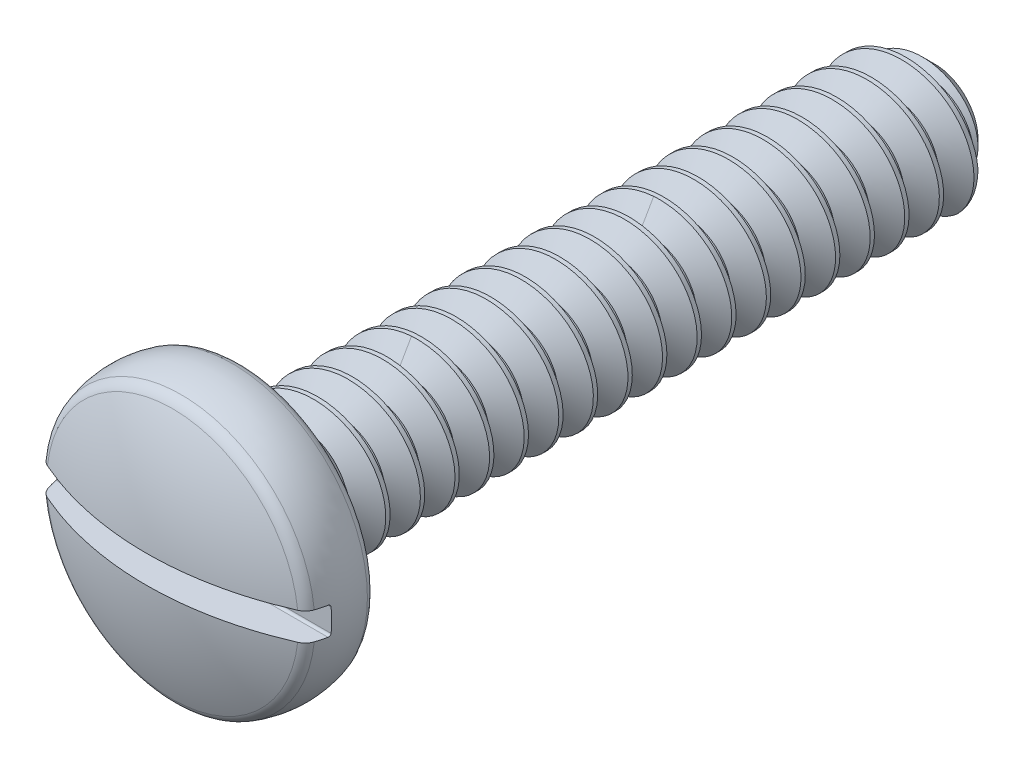
from build123d import *

# Parameters (mm, degrees)
CUT_EXTRUDE1_DEPTH      = 4.181587717
CUT_EXTRUDE1_DEPTH_BACK = 4.181587717
SKETCH9_W               = 0.35
SKETCH9_H               = 0.2
FILLET1_R               = 0.0175
FILLET2_R               = 0.105
CHAMFER1_SIZE           = 0.0825
SPLIT1_START            = -2.85
SPLIT1_OUTLINE_R        = 0.5
SPLIT1_DEPTH            = 4.75
CUT_SWEEP1_PITCH        = 0.25
LPATTERN1_COUNT         = 3
LPATTERN1_PITCH         = 1.75


# Read off the part's stored shape, not the designer's step: Split1
with BuildPart() as part:
    # Sketch2 → Revolve1 (revolve)
    with BuildSketch(Plane(origin=(0, 0, 0), x_dir=(0, 0, -1), z_dir=(1, 0, 0)), mode=Mode.PRIVATE) as revolve1_sk:
        with BuildLine():
            Line((-2.15, 0.95), (-2.15, 0.51))
            Line((-2.15, 0.51), (-1.9, 0.51))
            Line((-1.9, 0.51), (-1.9, 0.5))
            Line((-1.9, 0.5), (2.6625, 0.5))
            Line((2.6625, 0.5), (2.85, 0.3125))
            Line((2.85, 0.3125), (2.85, 0))
            Line((2.85, 0), (-2.85, 0))
            ThreePointArc((-2.85, 0), (-2.796873863, 0.486466854), (-2.64, 0.95))
            ThreePointArc((-2.64, 0.95), (-2.395, 1), (-2.15, 0.95))
        make_face()
    revolve(revolve1_sk.sketch.rotate(Axis((0, 0, 2.85), (0, 0, -1)), 90), axis=Axis((0, 0, 2.85), (0, 0, -1)))

    # Sketch9 → Cut-Extrude1 (cut, two sides: drawn at the far end of the back side and taken through both)
    with BuildSketch(Plane(origin=(0, 0, 0), x_dir=(0, 0, -1), z_dir=(1, 0, 0)).offset(-CUT_EXTRUDE1_DEPTH_BACK)):
        with Locations((-2.675, 0)):
            Rectangle(SKETCH9_W, SKETCH9_H)
    extrude(amount=CUT_EXTRUDE1_DEPTH + CUT_EXTRUDE1_DEPTH_BACK, mode=Mode.SUBTRACT)

    # Fillet1
    fillet1_edges = [part.edges().sort_by_distance(p)[0] for p in [
        (0, 0.1, 2.5),
        (0, -0.1, 2.5),
    ]]
    fillet(fillet1_edges, radius=FILLET1_R)

    # Fillet2
    fillet2_edges = [part.edges().sort_by_distance(p)[0] for p in [
        (-0.95, 0, 2.15),
        (0, -0.95, 2.64),
        (0, 0.95, 2.64),
    ]]
    fillet(fillet2_edges, radius=FILLET2_R)

    # Chamfer1
    chamfer1_edges = [part.edges().sort_by_distance(p)[0] for p in [
        (-0.51, 0, 2.15),
    ]]
    chamfer(chamfer1_edges, length=CHAMFER1_SIZE)

    # Split1 outline → Split1 (cut)
    with BuildSketch(Plane.XY.offset(SPLIT1_START)):
        Circle(SPLIT1_OUTLINE_R)
    extrude(amount=SPLIT1_DEPTH, mode=Mode.SUBTRACT)



with BuildPart() as body_2:
    # Split1 2 outline → Split1 2 (revolve)
    with BuildSketch(Plane.XZ):
        Polygon((0.5, 1.9), (0, 1.9), (0, -2.85), (0.3125, -2.85), (0.5, -2.6625), align=None)
    revolve(axis=Axis((0, 0, 0), (0, 0, 1)))

    # Cut-Sweep1: the profile of Sketch7 profile screwed along a right-hand helix of 9 turns, 6 arcs to a turn; built about Z, then put on its axis
    cut_sweep1_z = Axis((0, 0, 0), (0, 0, 1))
    cut_sweep1_corners = [(0.5003, 0, 0.000173205), (0.5003, 0, -0.218923205), (0.337620237, 0, -0.125), (0.337620237, 0, -0.09375)]
    with BuildLine(mode=Mode.PRIVATE) as cut_sweep1_profile:
        Line(cut_sweep1_corners[0], cut_sweep1_corners[1])
        Line(cut_sweep1_corners[1], cut_sweep1_corners[2])
        Line(cut_sweep1_corners[2], cut_sweep1_corners[3])
        Line(cut_sweep1_corners[3], cut_sweep1_corners[0])
    cut_sweep1_cap = Face(cut_sweep1_profile.wire())
    cut_sweep1_turn_angles = [0, 30, 60, 90, 120, 150, 180, 210, 240, 270, 300, 330, 360]
    cut_sweep1_turn_weights = [1, 0.8660254037844387, 1, 0.8660254037844387, 1, 0.8660254037844387, 1, 0.8660254037844387, 1, 0.8660254037844387, 1, 0.8660254037844387, 1]
    cut_sweep1_turn_rails = [Edge.make_bspline([Vector(p[0], p[1], 0).rotate(cut_sweep1_z, cut_sweep1_turn_angles[k]) / cut_sweep1_turn_weights[k] + Vector(0, 0, p[2] + CUT_SWEEP1_PITCH * cut_sweep1_turn_angles[k] / 360) for k in range(13)], [0, 0, 0, 1, 1, 2, 2, 3, 3, 4, 4, 5, 5, 6, 6, 6], 2, cut_sweep1_turn_weights) for p in cut_sweep1_corners]
    cut_sweep1_turn_sides = [Face.make_surface_from_curves(cut_sweep1_turn_rails[p[0]], cut_sweep1_turn_rails[p[1]]) for p in [(0, 1), (1, 2), (2, 3), (3, 0)]]
    cut_sweep1 = Plane(origin=(0, 0, -2.85), x_dir=(0, 1, 0), z_dir=(0, 0, 1)) * Solid(Shell([*[p.moved(Location((0, 0, CUT_SWEEP1_PITCH * i))) for i in range(9) for p in cut_sweep1_turn_sides], cut_sweep1_cap, cut_sweep1_cap.rotate(cut_sweep1_z, 3240).moved(Location((0, 0, CUT_SWEEP1_PITCH * 3240 / 360)))]))
    add(cut_sweep1, mode=Mode.SUBTRACT)

    # LPattern1: Cut-Sweep1 ×3
    with Locations(*[(0, 0, i * LPATTERN1_PITCH) for i in range(1, LPATTERN1_COUNT)]):
        add(cut_sweep1, mode=Mode.SUBTRACT)


with BuildPart() as part_1:
    add(part.part)

    add(body_2.part)  # Boss-Extrude1 merges body 2
    # Boss-Extrude1 cone 1 section (through the dimple's axis) → Boss-Extrude1 (revolve)
    with BuildSketch(Plane(origin=(0, 0, 1.9), x_dir=(0, -1, 0), z_dir=(1, 0, 0))):
        Polygon((0, 0), (0.51, 0), (0, 0.51), align=None)
    revolve(axis=Axis((0, 0, 1.9), (0, 0, -1)))


solid = part_1.part
